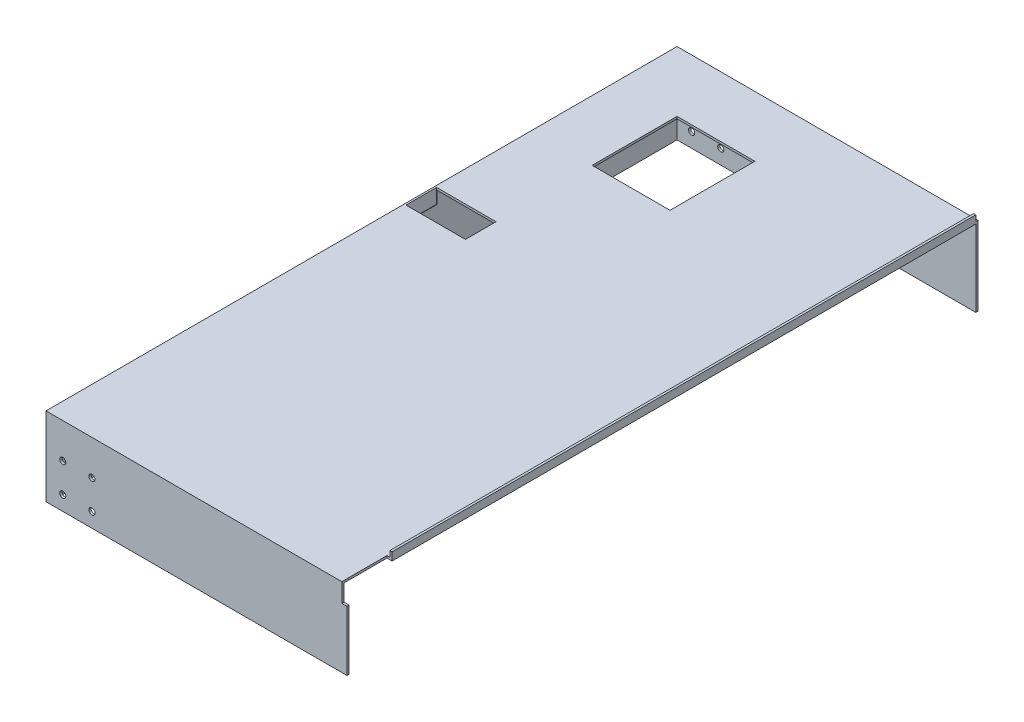
from build123d import *

# Parameters (mm, degrees)
BOSS_EXTRUDE4_DEPTH  = 1.5
SKETCH5_W            = 205
SKETCH5_H            = 54
BOSS_EXTRUDE5_DEPTH  = 1.5
SKETCH8_W            = 1.5
SKETCH8_H            = 430
BOSS_EXTRUDE14_DEPTH = 4
SKETCH7_W            = 205
SKETCH7_H            = 54
BOSS_EXTRUDE18_DEPTH = 1.5
SKETCH9_W            = 433
SKETCH9_H            = 54
BOSS_EXTRUDE19_DEPTH = 1.5
SKETCH10_R           = 2.1
CUT_EXTRUDE1_DEPTH   = 10
CUT_EXTRUDE2_START   = -10
SKETCH17_R           = 2.1
CUT_EXTRUDE2_DEPTH   = 10
SKETCH16_R           = 2.1
CUT_EXTRUDE3_DEPTH   = 10
CUT_EXTRUDE4_START   = -10
SKETCH11_R           = 2.1
CUT_EXTRUDE4_DEPTH   = 10
SKETCH12_R           = 2.1
CUT_EXTRUDE5_DEPTH   = 10
SKETCH13_R           = 2.1
CUT_EXTRUDE6_DEPTH   = 10
CUT_EXTRUDE7_START   = -10
SKETCH14_R           = 2.1
CUT_EXTRUDE7_DEPTH   = 10
CUT_EXTRUDE8_START   = -10
SKETCH15_R           = 2.1
CUT_EXTRUDE8_DEPTH   = 10
SKETCH18_W           = 40.776716255
SKETCH18_H           = 21.003646253
CUT_EXTRUDE9_DEPTH   = 10
SKETCH21_W           = 53.39484382
SKETCH21_H           = 58.234575778
CUT_EXTRUDE12_DEPTH  = 10
SKETCH23_W           = 3.513148775
SKETCH23_H           = 17.643959218
CUT_EXTRUDE14_DEPTH  = 31


with BuildPart() as part:
    # Sketch4 → Boss-Extrude4 (new body)
    with BuildSketch(Plane(origin=(0, 0, 0), x_dir=(1, 0, 0), z_dir=(0, 1, 0))):
        Polygon((124.01347733, 430), (329.01347733, 430), (329.01347733, 0), (124.01347733, 0), (124.01347733, 200), (124.01347733, 365), align=None)
    extrude(amount=BOSS_EXTRUDE4_DEPTH)

    # Sketch5 → Boss-Extrude5 (add)
    with BuildSketch(Plane.XY):
        with Locations((226.51347733, -25.5)):
            Rectangle(SKETCH5_W, SKETCH5_H)
    extrude(amount=BOSS_EXTRUDE5_DEPTH)

    # Sketch8 → Boss-Extrude14 (add)
    with BuildSketch(Plane(origin=(0, 1.5, 0), x_dir=(1, 0, 0), z_dir=(0, 1, 0))):
        with Locations((328.26347733, 215)):
            Rectangle(SKETCH8_W, SKETCH8_H)
    extrude(amount=BOSS_EXTRUDE14_DEPTH)

    # Sketch7 → Boss-Extrude18 (add)
    with BuildSketch(Plane(origin=(0, 0, -430), x_dir=(-1, 0, 0), z_dir=(0, 0, -1))):
        with Locations((-226.51347733, -25.5)):
            Rectangle(SKETCH7_W, SKETCH7_H)
    extrude(amount=BOSS_EXTRUDE18_DEPTH)

    # Sketch9 → Boss-Extrude19 (add)
    with BuildSketch(Plane.ZY.offset(-124.01347733)):
        with Locations((-215, -25.5)):
            Rectangle(SKETCH9_W, SKETCH9_H)
    extrude(amount=BOSS_EXTRUDE19_DEPTH)

    # Sketch10 → Cut-Extrude1 (cut)
    with BuildSketch(Plane(origin=(0, 0, -431.5), x_dir=(-1, 0, 0), z_dir=(0, 0, -1))):
        with Locations((-154.01347733, -42.5)):
            Circle(SKETCH10_R)
    extrude(amount=-CUT_EXTRUDE1_DEPTH, mode=Mode.SUBTRACT)

    # Sketch17 → Cut-Extrude2 (cut)
    with BuildSketch(Plane.XY.offset(1.5).offset(CUT_EXTRUDE2_START)):
        with Locations((154.01347733, -42.5)):
            Circle(SKETCH17_R)
    extrude(amount=CUT_EXTRUDE2_DEPTH, mode=Mode.SUBTRACT)

    # Sketch16 → Cut-Extrude3 (cut)
    with BuildSketch(Plane.XY.offset(1.5)):
        with Locations((134.023652304, -42.521836229)):
            Circle(SKETCH16_R)
    extrude(amount=-CUT_EXTRUDE3_DEPTH, mode=Mode.SUBTRACT)

    # Sketch11 → Cut-Extrude4 (cut)
    with BuildSketch(Plane(origin=(0, 0, -431.5), x_dir=(-1, 0, 0), z_dir=(0, 0, -1)).offset(CUT_EXTRUDE4_START)):
        with Locations((-134.023652304, -42.521836229)):
            Circle(SKETCH11_R)
    extrude(amount=CUT_EXTRUDE4_DEPTH, mode=Mode.SUBTRACT)

    # Sketch12 → Cut-Extrude5 (cut)
    with BuildSketch(Plane(origin=(0, 0, -431.5), x_dir=(-1, 0, 0), z_dir=(0, 0, -1))):
        with Locations((-134.017306734, -22.477341223)):
            Circle(SKETCH12_R)
    extrude(amount=-CUT_EXTRUDE5_DEPTH, mode=Mode.SUBTRACT)

    # Sketch13 → Cut-Extrude6 (cut)
    with BuildSketch(Plane(origin=(0, 0, -431.5), x_dir=(-1, 0, 0), z_dir=(0, 0, -1))):
        with Locations((-154.003183789, -22.514424589)):
            Circle(SKETCH13_R)
    extrude(amount=-CUT_EXTRUDE6_DEPTH, mode=Mode.SUBTRACT)

    # Sketch14 → Cut-Extrude7 (cut)
    with BuildSketch(Plane.XY.offset(1.5).offset(CUT_EXTRUDE7_START)):
        with Locations((134.017306734, -22.477341223)):
            Circle(SKETCH14_R)
    extrude(amount=CUT_EXTRUDE7_DEPTH, mode=Mode.SUBTRACT)

    # Sketch15 → Cut-Extrude8 (cut)
    with BuildSketch(Plane.XY.offset(1.5).offset(CUT_EXTRUDE8_START)):
        with Locations((154.003183789, -22.514424589)):
            Circle(SKETCH15_R)
    extrude(amount=CUT_EXTRUDE8_DEPTH, mode=Mode.SUBTRACT)

    # Sketch18 → Cut-Extrude9 (cut)
    with BuildSketch(Plane(origin=(0, 1.5, 0), x_dir=(1, 0, 0), z_dir=(0, 1, 0))):
        with Locations((144.123627747, 254.779446877)):
            Rectangle(SKETCH18_W, SKETCH18_H)
    extrude(amount=-CUT_EXTRUDE9_DEPTH, mode=Mode.SUBTRACT)

    # Sketch21 → Cut-Extrude12 (cut)
    with BuildSketch(Plane(origin=(0, 1.5, 0), x_dir=(1, 0, 0), z_dir=(0, 1, 0))):
        with Locations((190.71089924, 360.882712111)):
            Rectangle(SKETCH21_W, SKETCH21_H)
    extrude(amount=-CUT_EXTRUDE12_DEPTH, mode=Mode.SUBTRACT)

    # Sketch23 → Cut-Extrude14 (cut)
    with BuildSketch(Plane.XY.offset(1.5)):
        with Locations((327.256902943, -2.593639137)):
            Rectangle(SKETCH23_W, SKETCH23_H)
    extrude(amount=-CUT_EXTRUDE14_DEPTH, mode=Mode.SUBTRACT)


solid = part.part
